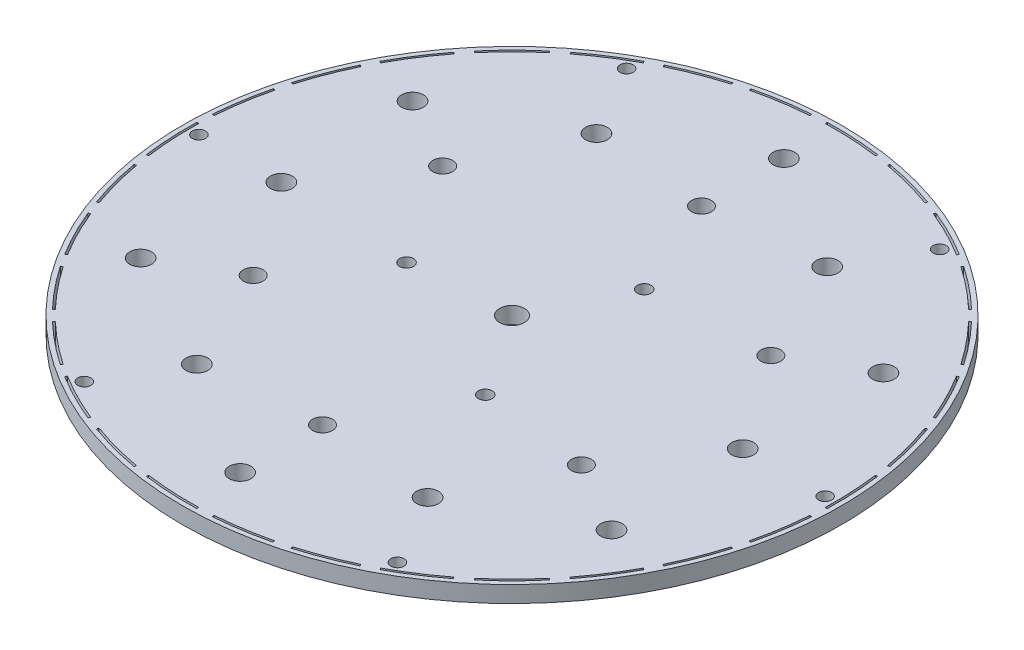
from build123d import *

# Parameters (mm, degrees)
SKETCH5_R                = 127
BOSS_EXTRUDE2_DEPTH      = 6.35
CUT_EXTRUDE1_DEPTH       = 6.35
CIRPATTERN1_COUNT        = 30
SKETCH9_R                = 2.667
CUT_EXTRUDE3_DEPTH       = 6.35
SKETCH10_R               = 4.7625
CUT_EXTRUDE4_DEPTH       = 6.35
CUT_EXTRUDE6_START       = -6.35
CUT_EXTRUDE6_OUTLINE_R   = 3.81
CUT_EXTRUDE6_OUTLINE_R_2 = 4.191
CUT_EXTRUDE6_OUTLINE_R_3 = 2.54
CUT_EXTRUDE6_DEPTH       = 6.35


# Read off the part's stored shape, not the designer's step: Cut-Extrude6
with BuildPart() as part:
    # Sketch5 → Boss-Extrude2 (new body)
    with BuildSketch(Plane(origin=(0, 0, 0), x_dir=(1, 0, 0), z_dir=(0, 1, 0))):
        with Locations(Location((0, 0, 0), (0, 0, 270))):
            Circle(SKETCH5_R)
    extrude(amount=BOSS_EXTRUDE2_DEPTH)

    # Sketch7 → Cut-Extrude1 (cut)
    with BuildSketch(Plane(origin=(0, 6.35, 0), x_dir=(1, 0, 0), z_dir=(0, 1, 0))):
        with BuildLine():
            Line((117.929515387, 42.203451159), (117.182180055, 41.936002166))
            ThreePointArc((117.182180055, 41.936002166), (117.210682769, 41.856271274), (117.239131234, 41.776521009))
            ThreePointArc((117.239131234, 41.776521009), (120.246669824, 32.10965581), (122.458580357, 22.23033281))
            Line((122.458580357, 22.23033281), (123.239566202, 22.372107892))
            ThreePointArc((123.239566202, 22.372107892), (120.991536987, 32.396757038), (117.929515387, 42.203451159))
        make_face()
    cut_extrude1 = extrude(amount=-CUT_EXTRUDE1_DEPTH, mode=Mode.SUBTRACT)

    # CirPattern1: Cut-Extrude1 ×30 about axis
    cirpattern1_axis = Axis((0, 0, 0), (0, 1, 0))
    for i in range(1, CIRPATTERN1_COUNT):
        add(cut_extrude1.rotate(cirpattern1_axis, i * 360 / CIRPATTERN1_COUNT), mode=Mode.SUBTRACT)

    # Sketch9 → Cut-Extrude3 (cut)
    with BuildSketch(Plane(origin=(0, 6.35, 0), x_dir=(1, 0, 0), z_dir=(0, 1, 0))):
        with Locations(Location((16.715770364, 34.237304525, 0), (0, 0, 270))):
            Circle(SKETCH9_R)
        with Locations(Location((21.292490294, -31.594934041, 0), (0, 0, 270))):
            Circle(SKETCH9_R)
        with Locations(Location((-38.008260658, -2.642370484, 0), (0, 0, 270))):
            Circle(SKETCH9_R)
    extrude(amount=-CUT_EXTRUDE3_DEPTH, mode=Mode.SUBTRACT)

    # Sketch10 → Cut-Extrude4 (cut)
    with BuildSketch(Plane(origin=(0, 6.35, 0), x_dir=(1, 0, 0), z_dir=(0, 1, 0))):
        with Locations(Location((0, 0, 0), (0, 0, 270))):
            Circle(SKETCH10_R)
    extrude(amount=-CUT_EXTRUDE4_DEPTH, mode=Mode.SUBTRACT)

    # Cut-Extrude6 outline → Cut-Extrude6 (cut)
    with BuildSketch(Plane(origin=(0, 6.35, 0), x_dir=(1, 0, 0), z_dir=(0, 1, 0)).offset(CUT_EXTRUDE6_START)):
        with Locations((0, 73.025)):
            Circle(CUT_EXTRUDE6_OUTLINE_R)
        with Locations((90.737811682, 52.3875)):
            Circle(CUT_EXTRUDE6_OUTLINE_R_2)
        with Locations((90.737811682, -52.3875)):
            Circle(CUT_EXTRUDE6_OUTLINE_R_2)
        with Locations((-60.325, 104.485964967)):
            Circle(CUT_EXTRUDE6_OUTLINE_R_3)
        with Locations((60.325, 104.485964967)):
            Circle(CUT_EXTRUDE6_OUTLINE_R_3)
        with Locations((120.65, 0)):
            Circle(CUT_EXTRUDE6_OUTLINE_R_3)
        with Locations((60.325, -104.485964967)):
            Circle(CUT_EXTRUDE6_OUTLINE_R_3)
        with Locations((-60.325, -104.485964967)):
            Circle(CUT_EXTRUDE6_OUTLINE_R_3)
        with Locations((-44.45, 76.989658396)):
            Circle(CUT_EXTRUDE6_OUTLINE_R_2)
        with Locations((0, -104.775)):
            Circle(CUT_EXTRUDE6_OUTLINE_R_2)
        with Locations((-63.241005111, 36.511633975)):
            Circle(CUT_EXTRUDE6_OUTLINE_R)
        with Locations((-63.240005111, -36.513366025)):
            Circle(CUT_EXTRUDE6_OUTLINE_R)
        with Locations((0.002, -73.025)):
            Circle(CUT_EXTRUDE6_OUTLINE_R)
        with Locations((63.243005111, -36.511633975)):
            Circle(CUT_EXTRUDE6_OUTLINE_R)
        with Locations((63.242005111, 36.513366025)):
            Circle(CUT_EXTRUDE6_OUTLINE_R)
        with Locations((-88.9, 0)):
            Circle(CUT_EXTRUDE6_OUTLINE_R_2)
        with Locations((0, 104.775)):
            Circle(CUT_EXTRUDE6_OUTLINE_R_2)
        with Locations((-90.737811682, 52.3875)):
            Circle(CUT_EXTRUDE6_OUTLINE_R_2)
        with Locations((-90.737811682, -52.3875)):
            Circle(CUT_EXTRUDE6_OUTLINE_R_2)
        with Locations((-120.65, 0)):
            Circle(CUT_EXTRUDE6_OUTLINE_R_3)
        with Locations((-44.45, -76.989658396)):
            Circle(CUT_EXTRUDE6_OUTLINE_R_2)
        with Locations((44.45, -76.989658396)):
            Circle(CUT_EXTRUDE6_OUTLINE_R_2)
        with Locations((88.9, 0)):
            Circle(CUT_EXTRUDE6_OUTLINE_R_2)
        with Locations((44.45, 76.989658396)):
            Circle(CUT_EXTRUDE6_OUTLINE_R_2)
    extrude(amount=CUT_EXTRUDE6_DEPTH, mode=Mode.SUBTRACT)


solid = part.part
